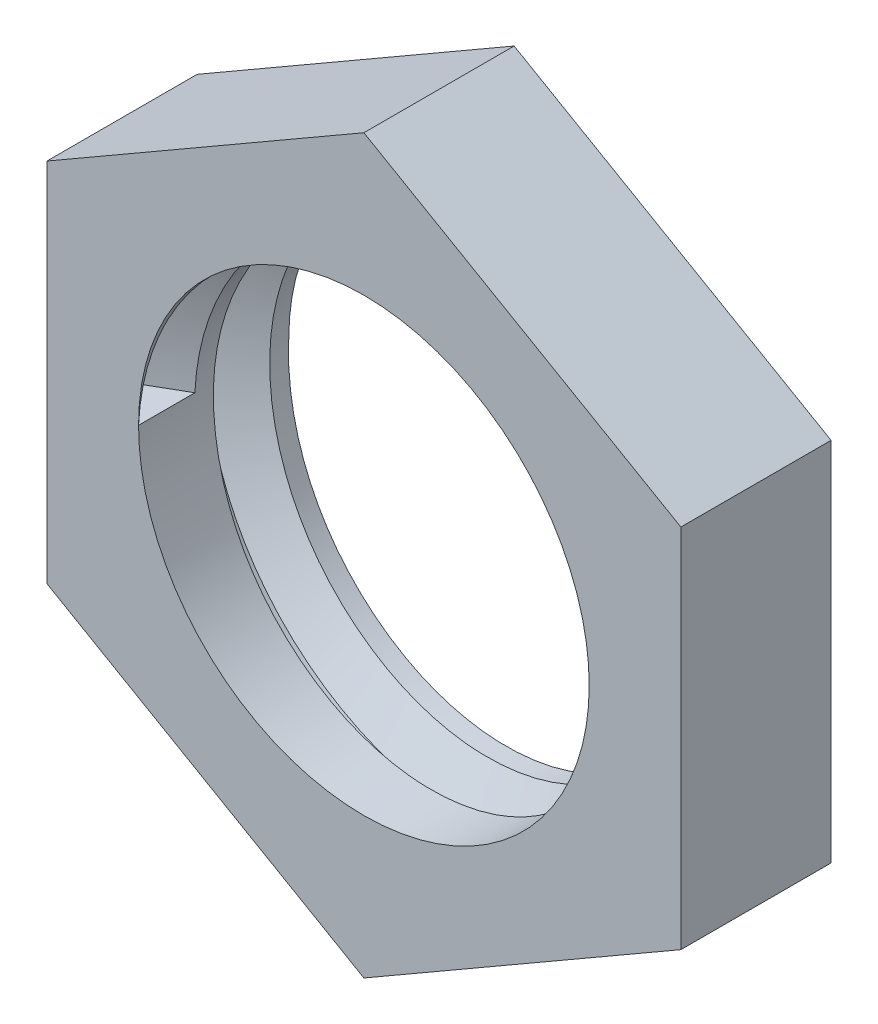
from build123d import *

# Parameters (mm, degrees)
SKETCH1_R           = 3
BOSS_EXTRUDE1_DEPTH = 2
THREAD1_PITCH       = 1


with BuildPart() as part:
    # Sketch1 → Boss-Extrude1 (new body)
    with BuildSketch(Plane.XY):
        Polygon((-4.22, -2.436418136), (0, -4.872836272), (4.22, -2.436418136), (4.22, 2.436418136), (0, 4.872836272), (-4.22, 2.436418136), align=None)
        Circle(SKETCH1_R, mode=Mode.SUBTRACT)
    extrude(amount=BOSS_EXTRUDE1_DEPTH)

    # Thread1: the profile of Thread Profile1 profile screwed along a right-hand helix of 2 turns, 8 arcs to a turn; built about Z, then put on its axis
    thread1_z = Axis((0, 0, 0), (0, 0, 1))
    thread1_corners = [(2.9997, 0, -0.000173205), (3.541265875, 0, 0.312499999), (3.541265875, 0, 0.437499999), (2.9997, 0, 0.750173202)]
    with BuildLine(mode=Mode.PRIVATE) as thread1_profile:
        Line(thread1_corners[0], thread1_corners[1])
        Line(thread1_corners[1], thread1_corners[2])
        Line(thread1_corners[2], thread1_corners[3])
        Line(thread1_corners[3], thread1_corners[0])
    thread1_cap = Face(thread1_profile.wire())
    thread1_turn_angles = [0, 22.5, 45, 67.5, 90, 112.5, 135, 157.5, 180, 202.5, 225, 247.5, 270, 292.5, 315, 337.5, 360]
    thread1_turn_weights = [1, 0.9238795325112867, 1, 0.9238795325112867, 1, 0.9238795325112867, 1, 0.9238795325112867, 1, 0.9238795325112867, 1, 0.9238795325112867, 1, 0.9238795325112867, 1, 0.9238795325112867, 1]
    thread1_turn_rails = [Edge.make_bspline([Vector(p[0], p[1], 0).rotate(thread1_z, thread1_turn_angles[k]) / thread1_turn_weights[k] + Vector(0, 0, p[2] + THREAD1_PITCH * thread1_turn_angles[k] / 360) for k in range(17)], [0, 0, 0, 1, 1, 2, 2, 3, 3, 4, 4, 5, 5, 6, 6, 7, 7, 8, 8, 8], 2, thread1_turn_weights) for p in thread1_corners]
    thread1_turn_sides = [Face.make_surface_from_curves(thread1_turn_rails[p[0]], thread1_turn_rails[p[1]]) for p in [(0, 1), (1, 2), (2, 3), (3, 0)]]
    thread1 = Plane(origin=(0, 0, 2), x_dir=(-1, 0, 0), z_dir=(0, 0, -1)) * Solid(Shell([*[p.moved(Location((0, 0, THREAD1_PITCH * i))) for i in range(2) for p in thread1_turn_sides], thread1_cap, thread1_cap.rotate(thread1_z, 720).moved(Location((0, 0, THREAD1_PITCH * 720 / 360)))]))
    add(thread1, mode=Mode.SUBTRACT)


solid = part.part
